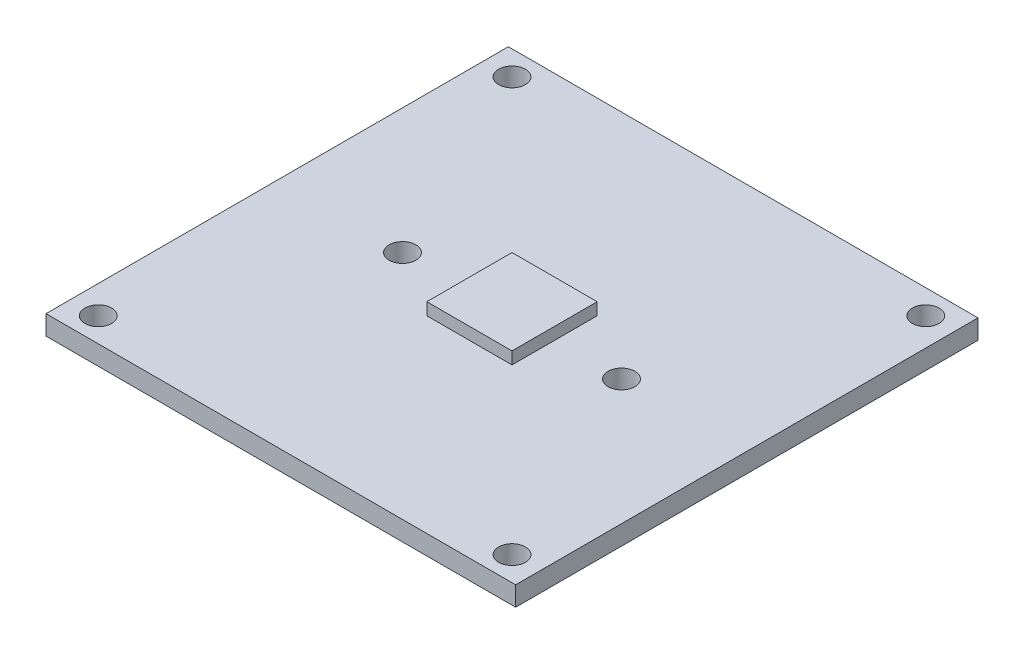
from build123d import *

# Parameters (mm, degrees)
SKETCH1_W               = 38.6
SKETCH1_H               = 38
SKETCH1_R               = 1.1
CAMERA_BOARD_BASE_DEPTH = 1.6
SKETCH1_5_W             = 7
SKETCH1_5_H             = 7
SENSOR_DEPTH            = 1


with BuildPart() as part:
    # Sketch1 → Camera Board Base (new body)
    with BuildSketch(Plane(origin=(0, 0, 0), x_dir=(1, 0, 0), z_dir=(0, 1, 0))):
        Rectangle(SKETCH1_W, SKETCH1_H)
        with Locations((-17, -17)):
            Circle(SKETCH1_R, mode=Mode.SUBTRACT)
        with Locations((17, -17)):
            Circle(SKETCH1_R, mode=Mode.SUBTRACT)
        with Locations((-9, 0)):
            Circle(SKETCH1_R, mode=Mode.SUBTRACT)
        with Locations((-17, 17)):
            Circle(SKETCH1_R, mode=Mode.SUBTRACT)
        with Locations((9, 0)):
            Circle(SKETCH1_R, mode=Mode.SUBTRACT)
        with Locations((17, 17)):
            Circle(SKETCH1_R, mode=Mode.SUBTRACT)
    extrude(amount=-CAMERA_BOARD_BASE_DEPTH)

    # Sketch1<5> → Sensor (add)
    with BuildSketch(Plane(origin=(0, 0, 0), x_dir=(1, 0, 0), z_dir=(0, 1, 0))):
        Rectangle(SKETCH1_5_W, SKETCH1_5_H)
    extrude(amount=SENSOR_DEPTH)


solid = part.part
